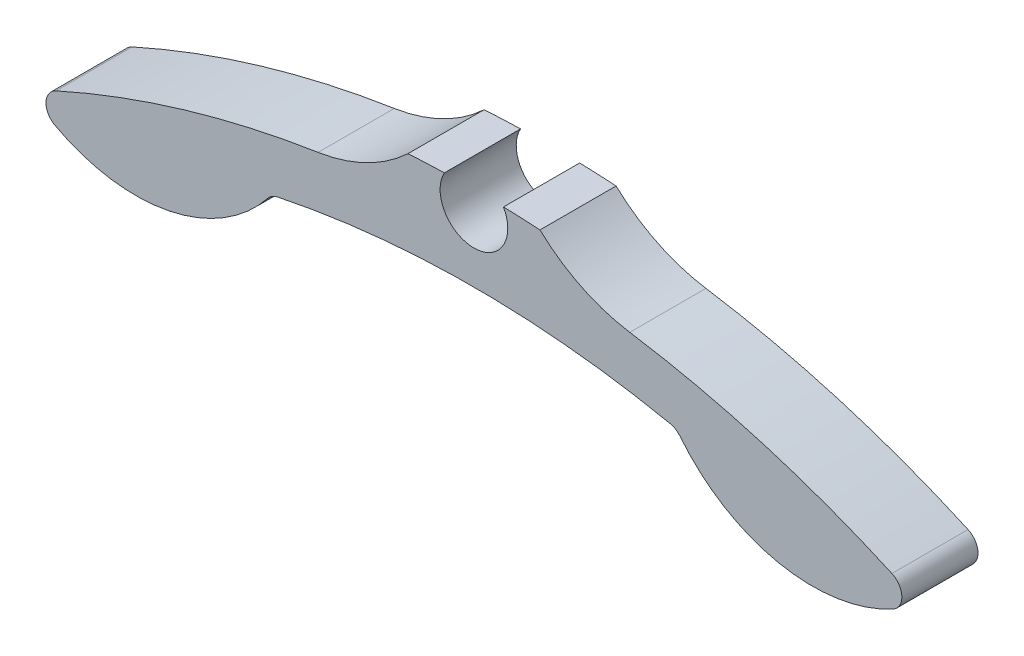
from build123d import *

# Parameters (mm, degrees)
BOSS_EXTRUDE1_DEPTH = 4.5
CUT_EXTRUDE1_DEPTH  = 30.661852099
FILLET1_R           = 10
FILLET2_R           = 1


with BuildPart() as part:
    # Sketch2 → Boss-Extrude1 (new body)
    with BuildSketch(Plane.XY):
        with BuildLine():
            ThreePointArc((-1.74598224, 0.975472203), (0, -2), (1.74598224, 0.975472203))
            ThreePointArc((1.74598224, 0.975472203), (15.131316317, -0.869946427), (27.801563151, -5.564366886))
            ThreePointArc((27.801563151, -5.564366886), (19.812423986, -9.306761236), (11.969278721, -5.267338946))
            ThreePointArc((11.969278721, -5.267338946), (0, -4), (-11.969278721, -5.267338946))
            ThreePointArc((-11.969278721, -5.267338946), (-19.812423986, -9.306761236), (-27.801563151, -5.564366886))
            ThreePointArc((-27.801563151, -5.564366886), (-15.131316317, -0.869946427), (-1.74598224, 0.975472203))
        make_face()
    extrude(amount=BOSS_EXTRUDE1_DEPTH)

    # Sketch3 → Cut-Extrude1 (cut, through all)
    with BuildSketch(Plane.XY.offset(4.5)):
        with BuildLine():
            ThreePointArc((-3.839229312, -1.122638985), (-15.367183828, -2.995958524), (-26.315878496, -7.061563826))
            ThreePointArc((-26.315878496, -7.061563826), (-27.098305385, -6.352245543), (-27.801563151, -5.564366886))
            ThreePointArc((-27.801563151, -5.564366886), (-16.175980809, -1.141817117), (-3.902593708, 0.877361015))
            ThreePointArc((-3.902593708, 0.877361015), (-3.997993987, -0.126665237), (-3.839229312, -1.122638985))
        make_face()
        with BuildLine():
            ThreePointArc((26.315878496, -7.061563826), (15.367183828, -2.995958524), (3.839229312, -1.122638985))
            ThreePointArc((3.839229312, -1.122638985), (3.997993987, -0.126665237), (3.902593708, 0.877361015))
            ThreePointArc((3.902593708, 0.877361015), (16.175980809, -1.141817117), (27.801563151, -5.564366886))
            ThreePointArc((27.801563151, -5.564366886), (27.098305385, -6.352245543), (26.315878496, -7.061563826))
        make_face()
    extrude(amount=-CUT_EXTRUDE1_DEPTH, mode=Mode.SUBTRACT)

    # Fillet1
    # the kernel refuses this fillet: 10 mm, written as the material it adds along each edge
    with BuildSketch(Plane(origin=(-3.839229312, -1.122638985, 4.5), x_dir=(-0.9940877478699028, -0.10857969209269472, 0), z_dir=(0, 0, -1))) as fillet1_piece_1:
        with BuildLine():
            CenterArc((5.852686638, 9.989908799), FILLET1_R, 233.080982265, 34.344798216)
            Line((-0.154169614, 1.995055582), (-0.27430674, 1.835158518))
            ThreePointArc((-0.27430674, 1.835158518), (-0.14972201, 0.99191469), (-0.196921331, 0.034956966))
            Line((-0.196921331, 0.034956966), (0.008982698, -0.199798176))
            ThreePointArc((0.008982698, -0.199798176), (2.701775857, -0.139296277), (5.394569015, -0.199798176))
            Line((5.394569015, -0.199798176), (5.403551713, 0))
        make_face()
    extrude(amount=4.5)
    with BuildSketch(Plane(origin=(3.839229312, -1.122638985, 4.5), x_dir=(0.9940877478699031, -0.10857969209269294, 0), z_dir=(0, 0, -1))) as fillet1_piece_2:
        with BuildLine():
            CenterArc((5.852686638, -9.989908799), FILLET1_R, 92.574219519, 34.344798216)
            Line((-0.154169614, -1.995055582), (-0.27430674, -1.835158518))
            ThreePointArc((-0.27430674, -1.835158518), (-0.14972201, -0.99191469), (-0.196921331, -0.034956966))
            Line((-0.196921331, -0.034956966), (0.008982698, 0.199798176))
            ThreePointArc((0.008982698, 0.199798176), (2.701775857, 0.139296277), (5.394569015, 0.199798176))
            Line((5.394569015, 0.199798176), (5.403551713, 0))
        make_face()
    extrude(amount=4.5)

    # Fillet2
    fillet2_edges = [part.edges().sort_by_distance(p)[0] for p in [
        (11.969278721, -5.267338946, 2.25),
        (-11.969278721, -5.267338946, 2.25),
        (26.315878496, -7.061563826, 2.25),
        (-26.315878496, -7.061563826, 2.25),
    ]]
    fillet(fillet2_edges, radius=FILLET2_R)


solid = part.part
